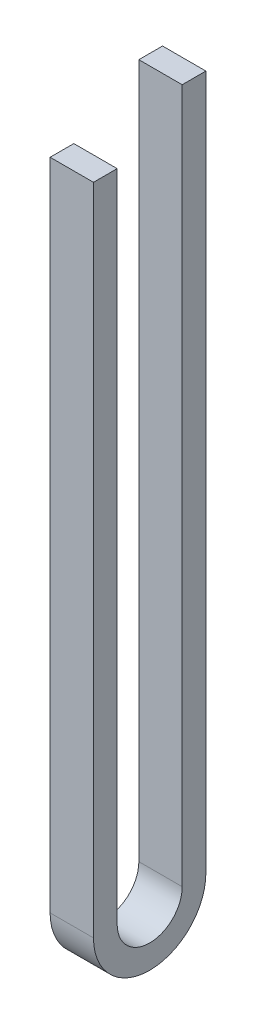
from build123d import *

# Parameters (mm, degrees)
BOSS_EXTRUDE1_DEPTH = 27.432


with BuildPart() as part:
    # Sketch1 → Boss-Extrude1 (new body)
    with BuildSketch(Plane(origin=(0, 0, 0), x_dir=(0, 0, -1), z_dir=(1, 0, 0))):
        with BuildLine():
            Line((0, 0), (0, -414.042482619))
            ThreePointArc((0, -414.042482619), (35.56, -449.602482619), (71.12, -414.042482619))
            Line((71.12, -414.042482619), (71.12, 25.4))
            Line((71.12, 25.4), (56.134, 25.4))
            Line((56.134, 25.4), (56.134, -414.042482619))
            ThreePointArc((56.134, -414.042482619), (35.56, -434.616482619), (14.986, -414.042482619))
            Line((14.986, -414.042482619), (14.986, 0))
            Line((14.986, 0), (0, 0))
        make_face()
    extrude(amount=BOSS_EXTRUDE1_DEPTH)


solid = part.part
